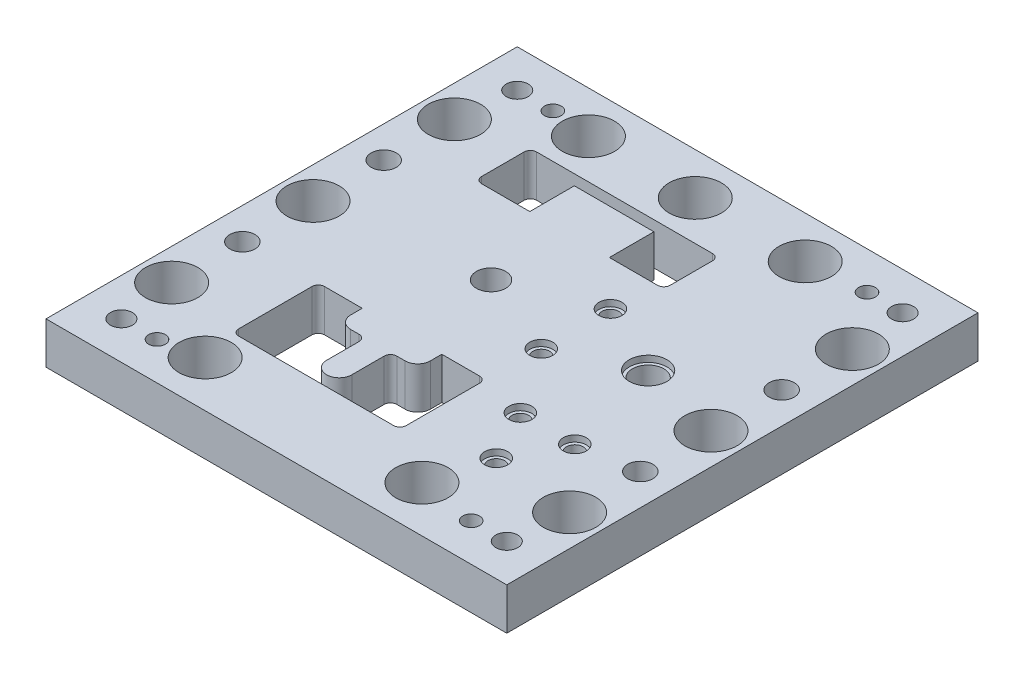
from build123d import *

# Parameters (mm, degrees)
SKETCH1_W                                    = 220
SKETCH1_H                                    = 225
BOSS_EXTRUDE1_DEPTH                          = 20
CUT_EXTRUDE3_REACH                           = 160.607
CUT_EXTRUDE4_REACH                           = 160.607
CUT_EXTRUDE5_REACH                           = 160.607
SKETCH7_R                                    = 4
CUT_EXTRUDE6_REACH                           = 160.607
SKETCH9_R                                    = 7.5
SKETCH10_R                                   = 5.5
CUT_EXTRUDE7_DEPTH                           = 3
SKETCH11_R                                   = 9
CUT_EXTRUDE8_DEPTH                           = 3
CBORE_FOR_M10_HEX_SOCKET_HEAD_CAP_SC_2_COUNT = 2
CBORE_FOR_M10_HEX_SOCKET_HEAD_CAP_SC_2_PITCH = 184
CBORE_FOR_M10_HEX_SOCKET_HEAD_CAP_SC_3_COUNT = 2
CBORE_FOR_M10_HEX_SOCKET_HEAD_CAP_SC_3_PITCH = 263.774524926
CBORE_FOR_M10_HEX_SOCKET_HEAD_CAP_SC_4_COUNT = 2
CBORE_FOR_M10_HEX_SOCKET_HEAD_CAP_SC_4_PITCH = 189
F_8_0MM_DOWEL_HOLE1_D                        = 8
F_25_0_25_DIAMETER_HOLE1_D                   = 25
CUT_EXTRUDE9_REACH                           = 160.607
SKETCH26_R                                   = 7
F_12_0_12_DIAMETER_HOLE1_D                   = 12


with BuildPart() as part:
    # Sketch1 → Boss-Extrude1 (new body)
    with BuildSketch(Plane(origin=(0, 0, 0), x_dir=(1, 0, 0), z_dir=(0, 1, 0))):
        Rectangle(SKETCH1_W, SKETCH1_H)
    extrude(amount=-BOSS_EXTRUDE1_DEPTH)

    # Sketch5 → Cut-Extrude3 (cut, up to next)
    with BuildSketch(Plane(origin=(0, 0, 0), x_dir=(1, 0, 0), z_dir=(0, 1, 0)), mode=Mode.PRIVATE) as cut_extrude3_sk1:
        with BuildLine():
            Line((-0.87, -38.14), (-0.87, -32.64))
            Line((-0.87, -32.64), (17.13, -32.64))
            ThreePointArc((17.13, -32.64), (19.251320344, -33.518679656), (20.13, -35.64))
            Line((20.13, -35.64), (20.13, -70.64))
            ThreePointArc((20.13, -70.64), (19.251320344, -72.761320344), (17.13, -73.64))
            Line((17.13, -73.64), (-56.87, -73.64))
            ThreePointArc((-56.87, -73.64), (-58.991320344, -72.761320344), (-59.87, -70.64))
            Line((-59.87, -70.64), (-59.87, -35.64))
            ThreePointArc((-59.87, -35.64), (-58.991320344, -33.518679656), (-56.87, -32.64))
            Line((-56.87, -32.64), (-38.87, -32.64))
            Line((-38.87, -32.64), (-38.87, -38.14))
            ThreePointArc((-38.87, -38.14), (-37.112640687, -42.382640687), (-32.87, -44.14))
            Line((-32.87, -44.14), (-28.87, -44.14))
            ThreePointArc((-28.87, -44.14), (-26.748679656, -45.018679656), (-25.87, -47.14))
            Line((-25.87, -47.14), (-25.87, -62.64))
            ThreePointArc((-25.87, -62.64), (-19.87, -68.64), (-13.87, -62.64))
            Line((-13.87, -62.64), (-13.87, -47.14))
            ThreePointArc((-13.87, -47.14), (-12.991320344, -45.018679656), (-10.87, -44.14))
            Line((-10.87, -44.14), (-6.87, -44.14))
            ThreePointArc((-6.87, -44.14), (-2.627359313, -42.382640687), (-0.87, -38.14))
        make_face()
    cut_extrude3_tool1 = extrude(cut_extrude3_sk1.sketch, amount=-CUT_EXTRUDE3_REACH, mode=Mode.PRIVATE) & part.part
    add(cut_extrude3_tool1.solids().sort_by_distance((-19.87, 0, 69.538944))[0], mode=Mode.SUBTRACT)

    # Sketch6 → Cut-Extrude4 (cut, up to next)
    with BuildSketch(Plane(origin=(0, 0, 0), x_dir=(1, 0, 0), z_dir=(0, 1, 0)), mode=Mode.PRIVATE) as cut_extrude4_sk1:
        with BuildLine():
            Line((-38.87, 47.36), (-61.87, 47.36))
            ThreePointArc((-61.87, 47.36), (-63.991320344, 48.238679656), (-64.87, 50.36))
            Line((-64.87, 50.36), (-64.87, 70.64))
            ThreePointArc((-64.87, 70.64), (-63.991320344, 72.761320344), (-61.87, 73.64))
            Line((-61.87, 73.64), (22.13, 73.64))
            ThreePointArc((22.13, 73.64), (24.251320344, 72.761320344), (25.13, 70.64))
            Line((25.13, 70.64), (25.13, 50.36))
            ThreePointArc((25.13, 50.36), (24.251320344, 48.238679656), (22.13, 47.36))
            Line((22.13, 47.36), (-0.87, 47.36))
            Line((-0.87, 47.36), (-0.87, 68.64))
            Line((-0.87, 68.64), (-38.87, 68.64))
            Line((-38.87, 68.64), (-38.87, 47.36))
        make_face()
    cut_extrude4_tool1 = extrude(cut_extrude4_sk1.sketch, amount=-CUT_EXTRUDE4_REACH, mode=Mode.PRIVATE) & part.part
    add(cut_extrude4_tool1.solids().sort_by_distance((-50.37, 0, -48.297584))[0], mode=Mode.SUBTRACT)

    # Sketch7 → Cut-Extrude5 (cut, up to next)
    with BuildSketch(Plane(origin=(0, 0, 0), x_dir=(1, 0, 0), z_dir=(0, 1, 0)), mode=Mode.PRIVATE) as cut_extrude5_sk1:
        with Locations((55.13, -62.64)):
            Circle(SKETCH7_R)
    cut_extrude5_tool1 = extrude(cut_extrude5_sk1.sketch, amount=-CUT_EXTRUDE5_REACH, mode=Mode.PRIVATE) & part.part
    # Sketch7 → Cut-Extrude5 (cut, up to next)
    with BuildSketch(Plane(origin=(0, 0, 0), x_dir=(1, 0, 0), z_dir=(0, 1, 0)), mode=Mode.PRIVATE) as cut_extrude5_sk2:
        with Locations((68.13, -38.14)):
            Circle(SKETCH7_R)
    cut_extrude5_tool2 = extrude(cut_extrude5_sk2.sketch, amount=-CUT_EXTRUDE5_REACH, mode=Mode.PRIVATE) & part.part
    # Sketch7 → Cut-Extrude5 (cut, up to next)
    with BuildSketch(Plane(origin=(0, 0, 0), x_dir=(1, 0, 0), z_dir=(0, 1, 0)), mode=Mode.PRIVATE) as cut_extrude5_sk3:
        with Locations((42.13, -38.14)):
            Circle(SKETCH7_R)
    cut_extrude5_tool3 = extrude(cut_extrude5_sk3.sketch, amount=-CUT_EXTRUDE5_REACH, mode=Mode.PRIVATE) & part.part
    # Sketch7 → Cut-Extrude5 (cut, up to next)
    with BuildSketch(Plane(origin=(0, 0, 0), x_dir=(1, 0, 0), z_dir=(0, 1, 0)), mode=Mode.PRIVATE) as cut_extrude5_sk4:
        with Locations((20.63, -6.64)):
            Circle(SKETCH7_R)
    cut_extrude5_tool4 = extrude(cut_extrude5_sk4.sketch, amount=-CUT_EXTRUDE5_REACH, mode=Mode.PRIVATE) & part.part
    # Sketch7 → Cut-Extrude5 (cut, up to next)
    with BuildSketch(Plane(origin=(0, 0, 0), x_dir=(1, 0, 0), z_dir=(0, 1, 0)), mode=Mode.PRIVATE) as cut_extrude5_sk5:
        with Locations((20.63, 26.36)):
            Circle(SKETCH7_R)
    cut_extrude5_tool5 = extrude(cut_extrude5_sk5.sketch, amount=-CUT_EXTRUDE5_REACH, mode=Mode.PRIVATE) & part.part
    add(cut_extrude5_tool1.solids().sort_by_distance((55.13, 0, 62.64))[0], mode=Mode.SUBTRACT)
    add(cut_extrude5_tool2.solids().sort_by_distance((68.13, 0, 38.14))[0], mode=Mode.SUBTRACT)
    add(cut_extrude5_tool3.solids().sort_by_distance((42.13, 0, 38.14))[0], mode=Mode.SUBTRACT)
    add(cut_extrude5_tool4.solids().sort_by_distance((20.63, 0, 6.64))[0], mode=Mode.SUBTRACT)
    add(cut_extrude5_tool5.solids().sort_by_distance((20.63, 0, -26.36))[0], mode=Mode.SUBTRACT)

    # Sketch9 → Cut-Extrude6 (cut, up to next)
    with BuildSketch(Plane(origin=(0, 0, 0), x_dir=(1, 0, 0), z_dir=(0, 1, 0)), mode=Mode.PRIVATE) as cut_extrude6_sk1:
        with Locations((55.13, 9.86)):
            Circle(SKETCH9_R)
    cut_extrude6_tool1 = extrude(cut_extrude6_sk1.sketch, amount=-CUT_EXTRUDE6_REACH, mode=Mode.PRIVATE) & part.part
    add(cut_extrude6_tool1.solids().sort_by_distance((55.13, 0, -9.86))[0], mode=Mode.SUBTRACT)

    # Sketch10 → Cut-Extrude7 (cut)
    with BuildSketch(Plane(origin=(0, 0, 0), x_dir=(1, 0, 0), z_dir=(0, 1, 0))):
        with Locations((20.63, 26.36)):
            Circle(SKETCH10_R)
        with Locations((20.63, -6.64)):
            Circle(SKETCH10_R)
        with Locations((42.13, -38.14)):
            Circle(SKETCH10_R)
        with Locations((68.13, -38.14)):
            Circle(SKETCH10_R)
        with Locations((55.13, -62.64)):
            Circle(SKETCH10_R)
    extrude(amount=-CUT_EXTRUDE7_DEPTH, mode=Mode.SUBTRACT)

    # Sketch11 → Cut-Extrude8 (cut)
    with BuildSketch(Plane(origin=(0, 0, 0), x_dir=(1, 0, 0), z_dir=(0, 1, 0))):
        with Locations((55.13, 9.86)):
            Circle(SKETCH11_R)
    extrude(amount=-CUT_EXTRUDE8_DEPTH, mode=Mode.SUBTRACT)

    # Sketch16 → CBORE for M10 Hex Socket Head Cap Screw1 (revolve, cut)
    with BuildSketch(Plane(origin=(92, -20, -94.5), x_dir=(0, 0, -1), z_dir=(1, 0, 0))):
        Polygon((0, 0), (0, 20), (5.25, 20), (5.25, 10.6), (9, 10.6), (9, 0.025), (9.025, 0), align=None)
    cbore_for_m10_hex_socket_head_cap_screw1 = revolve(axis=Axis((92, -26.35, -94.5), (0, 1, 0)), mode=Mode.SUBTRACT)

    # CBORE for M10 Hex Socket Head Cap Sc 2: CBORE for M10 Hex Socket Head Cap Screw1 ×2
    with Locations(*[(-i * CBORE_FOR_M10_HEX_SOCKET_HEAD_CAP_SC_2_PITCH, 0, 0) for i in range(1, CBORE_FOR_M10_HEX_SOCKET_HEAD_CAP_SC_2_COUNT)]):
        add(cbore_for_m10_hex_socket_head_cap_screw1, mode=Mode.SUBTRACT)

    # CBORE for M10 Hex Socket Head Cap Sc 3: CBORE for M10 Hex Socket Head Cap Screw1 ×2
    with Locations(*[Vector(-0.6975654682783963, 0, 0.7165210516555266) * (i * CBORE_FOR_M10_HEX_SOCKET_HEAD_CAP_SC_3_PITCH) for i in range(1, CBORE_FOR_M10_HEX_SOCKET_HEAD_CAP_SC_3_COUNT)]):
        add(cbore_for_m10_hex_socket_head_cap_screw1, mode=Mode.SUBTRACT)

    # CBORE for M10 Hex Socket Head Cap Sc 4: CBORE for M10 Hex Socket Head Cap Screw1 ×2
    with Locations(*[(0, 0, i * CBORE_FOR_M10_HEX_SOCKET_HEAD_CAP_SC_4_PITCH) for i in range(1, CBORE_FOR_M10_HEX_SOCKET_HEAD_CAP_SC_4_COUNT)]):
        add(cbore_for_m10_hex_socket_head_cap_screw1, mode=Mode.SUBTRACT)

    # Ø8.0mm Dowel Hole1 (through all)
    with Locations(Plane(origin=(0, -20, 0), x_dir=(-1, 0, 0), z_dir=(0, -1, 0))):
        with Locations((-75, 94.5), (75, 94.5), (75, -94.5), (-75, -94.5)):
            Hole(F_8_0MM_DOWEL_HOLE1_D / 2)

    # Ø25.0 (25) Diameter Hole1 (through all)
    with Locations(Plane(origin=(0, 0, 0), x_dir=(1, 0, 0), z_dir=(0, 1, 0))):
        with Locations((-56, 92.5), (-5, 92.5), (47.5, 92.5), (95, 67.5), (95, 0), (95, -67.5), (47.5, -90.5), (-56, -90.5), (-95, -67.5), (-95, 0), (-95, 67.5)):
            Hole(F_25_0_25_DIAMETER_HOLE1_D / 2)

    # Sketch26 → Cut-Extrude9 (cut, up to next)
    with BuildSketch(Plane(origin=(0, 0, 0), x_dir=(1, 0, 0), z_dir=(0, 1, 0)), mode=Mode.PRIVATE) as cut_extrude9_sk1:
        with Locations((-19.87, 9.86)):
            Circle(SKETCH26_R)
    cut_extrude9_tool1 = extrude(cut_extrude9_sk1.sketch, amount=-CUT_EXTRUDE9_REACH, mode=Mode.PRIVATE) & part.part
    add(cut_extrude9_tool1.solids().sort_by_distance((-19.87, 0, -9.86))[0], mode=Mode.SUBTRACT)

    # Ø12.0 (12) Diameter Hole1 (through all)
    with Locations(Plane(origin=(0, 0, 0), x_dir=(1, 0, 0), z_dir=(0, 1, 0))):
        with Locations((95, 33.75), (-95, 33.75), (-95, -33.75), (95, -33.75)):
            Hole(F_12_0_12_DIAMETER_HOLE1_D / 2)


solid = part.part
